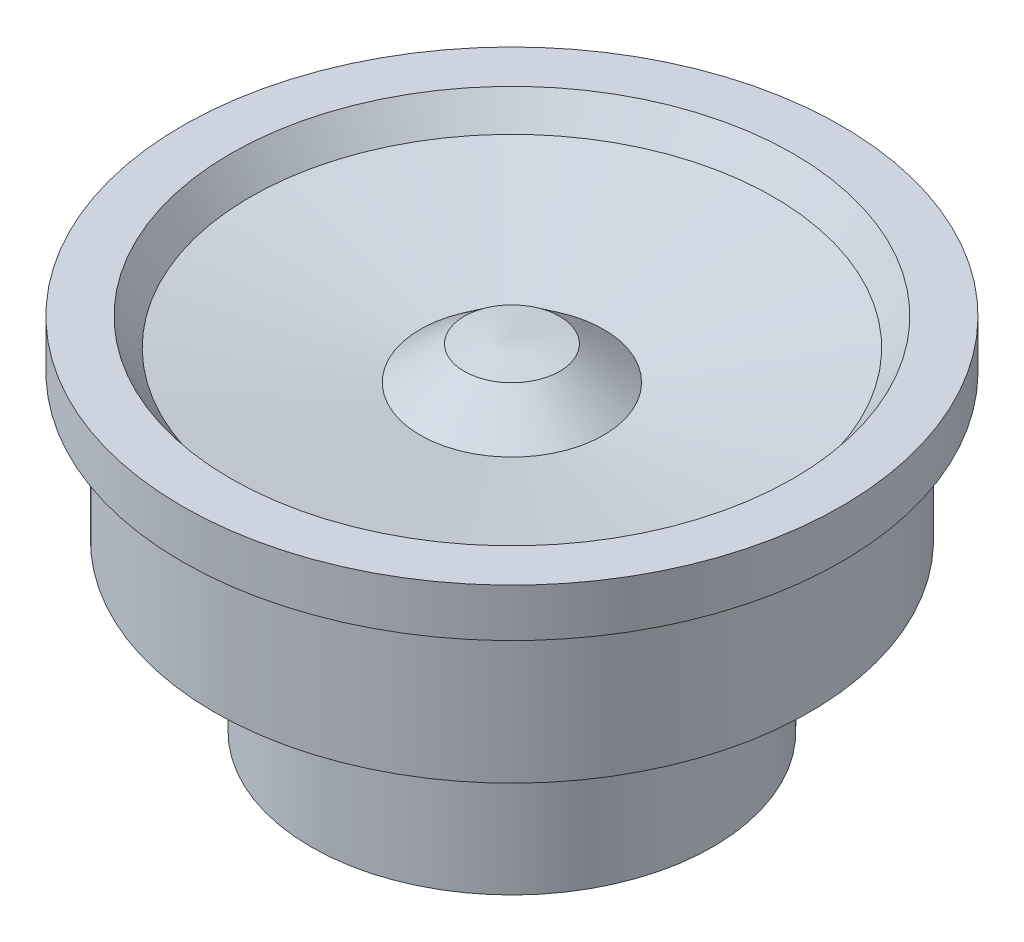
from build123d import *


with BuildPart() as part:
    # Sketch1 → Revolve1 (revolve)
    with BuildSketch(Plane.XY):
        Polygon((0, 0), (12.125, 0), (12.125, 10), (18, 10), (18, 18.8), (19.9, 18.8), (19.9, 21.7), (16.989165635, 21.7), (15.787103555, 20.042433077), (5.537942661, 18.239339957), (2.8807528, 20.25), (0, 20.611830904), align=None)
    revolve(axis=Axis((0, 21.7, 0), (0, -1, 0)))


solid = part.part
